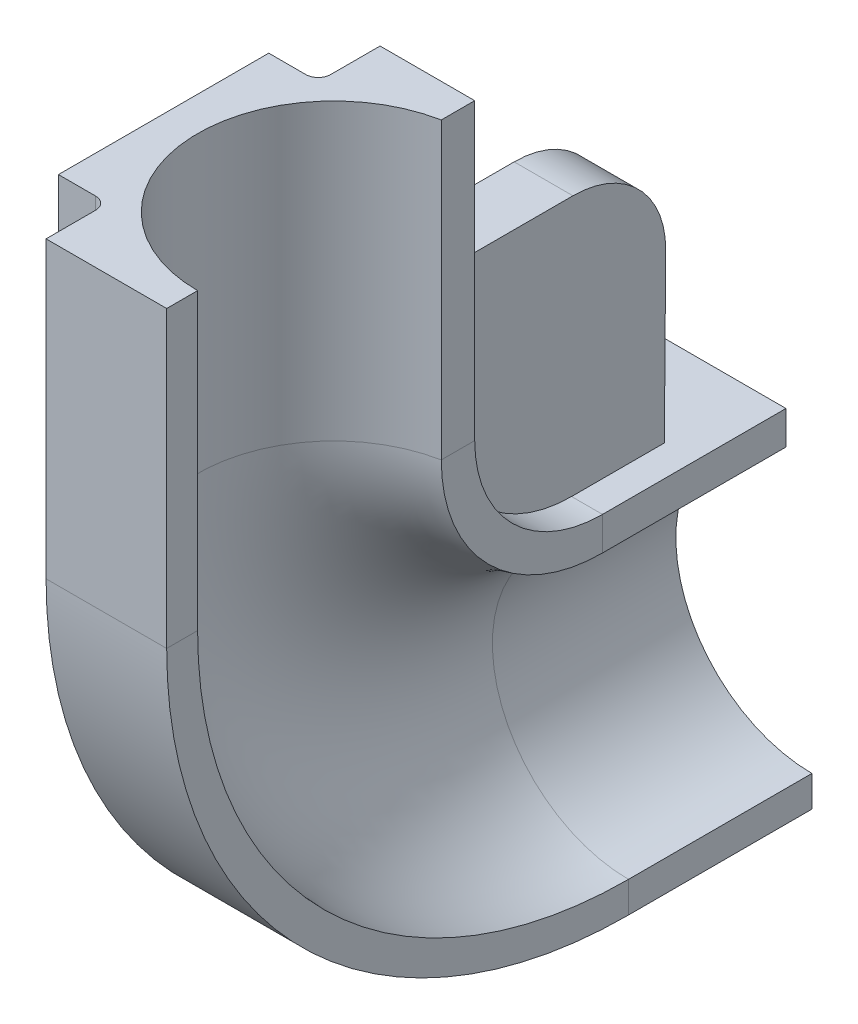
from build123d import *

# Parameters (mm, degrees)
EXTRUDE_1_DEPTH     = 6
SKETCH_4_R          = 1.6
CUT_EXTRUDE_1_DEPTH = 123.810830164
EXTRUDE_START       = -14.5
EXTRUDE_2_DEPTH     = 14.5
FILLET_1_R          = 15
CUT_EXTRUDE_3_DEPTH = 5


with BuildPart() as part:
    # 草图1 → 凸台-拉伸1 (new body)
    with BuildSketch(Plane.XY):
        with BuildLine():
            Line((0, 0), (27.5, 0))
            Line((27.5, 0), (27.5, -5))
            ThreePointArc((27.5, -5), (5.5, -27), (27.5, -49))
            Line((27.5, -49), (27.5, -54))
            Line((27.5, -54), (0, -54))
            Line((0, -54), (0, 0))
        make_face()
    extrude(amount=EXTRUDE_1_DEPTH)

    # 扫描1: sweep along a path in 草图3
    with BuildLine(Plane(origin=(27.5, 0, 0), x_dir=(0, 0, -1), z_dir=(1, 0, 0))) as sweep_1_path:
        Line((-6, -27), (-29.66, -27))
        ThreePointArc((-29.66, -27), (-63.360709191, -13.040709191), (-77.32, 20.66))
        Line((-77.32, 20.66), (-77.32, 68.26))
    # 草图2 → 扫描1 (sweep)
    with BuildSketch(Plane.XY.offset(6)):
        with BuildLine():
            Line((8, 0), (8, -8))
            ThreePointArc((8, -8), (7.414213562, -9.414213562), (6, -10))
            Line((6, -10), (0, -10))
            Line((0, -10), (0, -44))
            Line((0, -44), (6, -44))
            ThreePointArc((6, -44), (7.414213562, -44.585786438), (8, -46))
            Line((8, -46), (8, -54))
            Line((8, -54), (27.5, -54))
            Line((27.5, -54), (27.5, -49))
            ThreePointArc((27.5, -49), (5.5, -27), (27.5, -5))
            Line((27.5, -5), (27.5, 0))
            Line((27.5, 0), (8, 0))
        make_face()
    sweep(path=sweep_1_path.line)

    # 草图4 → 切除-拉伸1 (cut, through all)
    with BuildSketch(Plane.XY.offset(6)):
        with Locations((4.5, -5)):
            Circle(SKETCH_4_R)
    cut_extrude_1 = extrude(amount=-CUT_EXTRUDE_1_DEPTH, mode=Mode.SUBTRACT)

    # 镜向1: 切除-拉伸1 across plane
    add(cut_extrude_1.mirror(Plane.ZX.offset(-27)), mode=Mode.SUBTRACT)

    # 切除-扫描2: sweep along a path in 草图8
    with BuildLine(Plane(origin=(27.5, 0, 0), x_dir=(0, 0, -1), z_dir=(1, 0, 0))) as sweep_2_path:
        Line((0, -2.5), (-29.66, -2.5))
        ThreePointArc((-29.66, -2.5), (-46.036593052, 4.283406948), (-52.82, 20.66))
        Line((-52.82, 20.66), (-52.82, 68.26))
    # 草图7 → 切除-扫描2 (sweep, cut)
    with BuildSketch(Plane(origin=(0, 0, 0), x_dir=(-1, 0, 0), z_dir=(0, 0, -1))):
        with BuildLine():
            Line((-27.5, 0), (-23.3, 0))
            Line((-23.3, 0), (-23.3, -5.404630126))
            ThreePointArc((-23.3, -5.404630126), (-25.390276941, -5.101391172), (-27.5, -5))
            Line((-27.5, -5), (-27.5, 0))
        make_face()
    sweep(path=sweep_2_path.line, mode=Mode.SUBTRACT)

    # 草图9 → 凸台-拉伸2 (add)
    with BuildSketch(Plane(origin=(23.3, 0, 0), x_dir=(0, 0, -1), z_dir=(1, 0, 0)).offset(EXTRUDE_START)):
        with BuildLine():
            Line((-29.66, 0), (-14.66, 0))
            Line((-14.66, 0), (-14.32, 42))
            Line((-14.32, 42), (-50.32, 42))
            Line((-50.32, 42), (-50.32, 20.66))
            ThreePointArc((-50.32, 20.66), (-44.268826099, 6.051173901), (-29.66, 0))
        make_face()
    extrude(amount=EXTRUDE_2_DEPTH)

    # 圆角1
    fillet_1_edges = [part.edges().sort_by_distance(p)[0] for p in [
        (16.05, 42, 14.32),
    ]]
    fillet(fillet_1_edges, radius=FILLET_1_R)

    # 草图10 → 切除-拉伸3 (cut)
    with BuildSketch(Plane(origin=(23.3, 0, 0), x_dir=(0, 0, -1), z_dir=(1, 0, 0))):
        with BuildLine():
            Line((-29.44192006, 42), (-50.32, 42))
            Line((-50.32, 42), (-50.32, 20.66))
            ThreePointArc((-50.32, 20.66), (-44.268826099, 6.051173901), (-29.66, 0))
            Line((-29.66, 0), (-14.66, 0))
            Line((-14.66, 0), (-14.442411532, 26.878575407))
            ThreePointArc((-14.442411532, 26.878575407), (-18.792474795, 37.563584408), (-29.44192006, 42))
        make_face()
    extrude(amount=-CUT_EXTRUDE_3_DEPTH, mode=Mode.SUBTRACT)


solid = part.part
